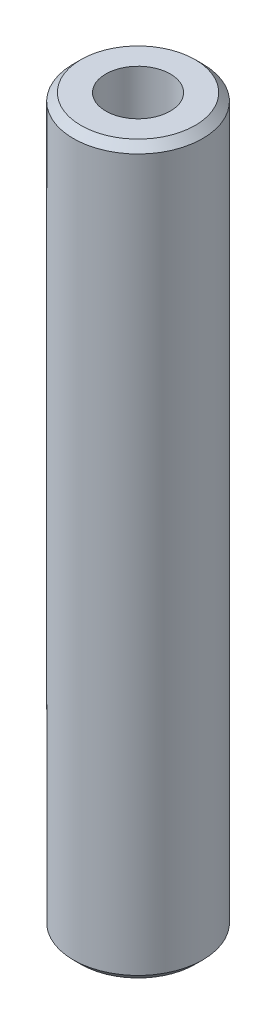
from build123d import *

# Parameters (mm, degrees)
SKETCH1_R           = 32.5
BOSS_EXTRUDE1_DEPTH = 365.264584804
SKETCH2_R           = 16.206036203
CUT_EXTRUDE1_DEPTH  = 369.144967251
CHAMFER1_SIZE       = 3.798772706


with BuildPart() as part:
    # Sketch1 → Boss-Extrude1 (new body)
    with BuildSketch(Plane(origin=(0, 0, 0), x_dir=(1, 0, 0), z_dir=(0, 1, 0))):
        Circle(SKETCH1_R)
    extrude(amount=BOSS_EXTRUDE1_DEPTH)

    # Sketch2 → Cut-Extrude1 (cut, through all)
    with BuildSketch(Plane(origin=(0, 0, 0), x_dir=(1, 0, 0), z_dir=(0, 1, 0))):
        Circle(SKETCH2_R)
    extrude(amount=CUT_EXTRUDE1_DEPTH, mode=Mode.SUBTRACT)

    # Chamfer1
    chamfer1_edges = [part.edges().sort_by_distance(p)[0] for p in [
        (-32.5, 365.264584804, 0),
        (-32.5, 0, 0),
    ]]
    chamfer(chamfer1_edges, length=CHAMFER1_SIZE)


solid = part.part
